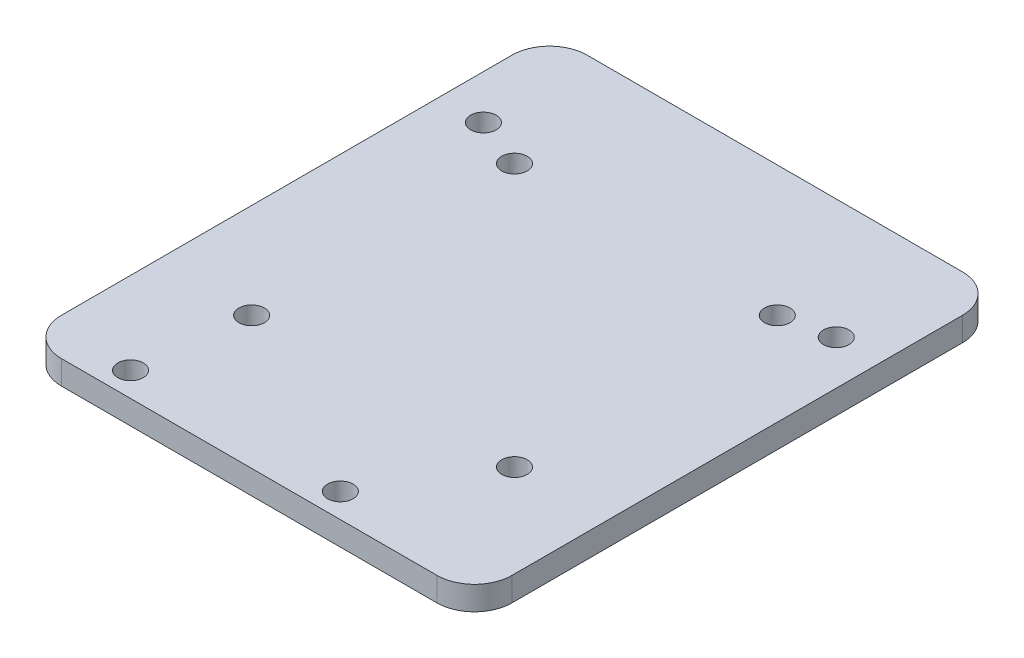
from build123d import *

# Parameters (mm, degrees)
SKETCH1_W            = 60
SKETCH1_H            = 70
BOSS_EXTRUDE1_DEPTH  = 3.175
M3_CLEARANCE_HOLE1_D = 3.4
M3_CLEARANCE_HOLE2_D = 3.4
FILLET1_R            = 5


with BuildPart() as part:
    # Sketch1 → Boss-Extrude1 (new body)
    with BuildSketch(Plane(origin=(0, 0, 0), x_dir=(1, 0, 0), z_dir=(0, 1, 0))):
        Rectangle(SKETCH1_W, SKETCH1_H)
    extrude(amount=BOSS_EXTRUDE1_DEPTH)

    # M3 Clearance Hole1 (through all)
    with Locations(Plane(origin=(0, 3.175, 0), x_dir=(1, 0, 0), z_dir=(0, 1, 0))):
        with Locations((17.675418598, 17.651666056), (17.675418598, -17.348333944), (-17.324581402, -17.348333944), (-17.324581402, 17.651666056)):
            Hole(M3_CLEARANCE_HOLE1_D / 2)

    # M3 Clearance Hole2 (through all)
    with Locations(Plane(origin=(0, 3.175, 0), x_dir=(1, 0, 0), z_dir=(0, 1, 0))):
        with Locations((-19.05, -31.75), (8.89, -31.75), (24.13, 19.05), (-24.13, 20.32)):
            Hole(M3_CLEARANCE_HOLE2_D / 2)

    # Fillet1
    fillet1_edges = [part.edges().sort_by_distance(p)[0] for p in [
        (-30, 1.5875, -35),
        (30, 1.5875, -35),
        (30, 1.5875, 35),
        (-30, 1.5875, 35),
    ]]
    fillet(fillet1_edges, radius=FILLET1_R)


solid = part.part
